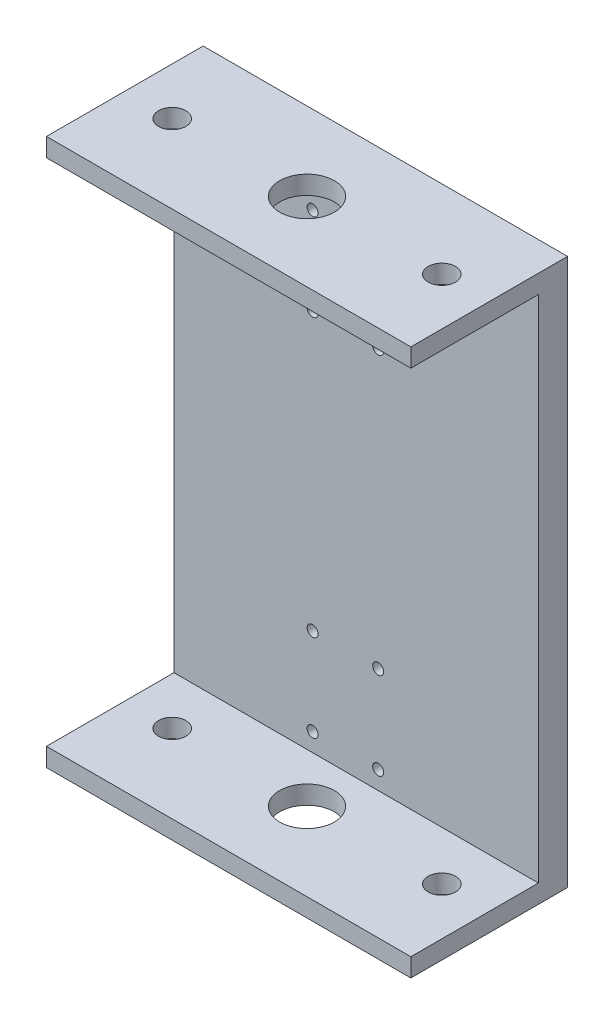
from build123d import *

# Parameters (mm, degrees)
SKETCH2_W           = 100
SKETCH2_H           = 150
SKETCH2_R           = 1.5
BOSS_EXTRUDE1_DEPTH = 8
SKETCH5_W           = 100
SKETCH5_H           = 5.066428815
BOSS_EXTRUDE2_DEPTH = 35
SKETCH7_R           = 7.5
SKETCH7_R_2         = 3.75
CUT_EXTRUDE2_DEPTH  = 290


with BuildPart() as part:
    # Sketch2 → Boss-Extrude1 (new body)
    with BuildSketch(Plane.XY):
        with Locations((-3.365, 15)):
            Rectangle(SKETCH2_W, SKETCH2_H)
        with Locations((-15.33, 74.016821687)):
            Circle(SKETCH2_R, mode=Mode.SUBTRACT)
        with Locations((-15.33, -25.983178313)):
            Circle(SKETCH2_R, mode=Mode.SUBTRACT)
        with Locations((-15.33, 50.088093446)):
            Circle(SKETCH2_R, mode=Mode.SUBTRACT)
        with Locations((2.67, 50.088093446)):
            Circle(SKETCH2_R, mode=Mode.SUBTRACT)
        with Locations((2.67, 74.016821687)):
            Circle(SKETCH2_R, mode=Mode.SUBTRACT)
        with Locations((-15.33, -49.911906554)):
            Circle(SKETCH2_R, mode=Mode.SUBTRACT)
        with Locations((2.67, -49.911906554)):
            Circle(SKETCH2_R, mode=Mode.SUBTRACT)
        with Locations((2.67, -25.983178313)):
            Circle(SKETCH2_R, mode=Mode.SUBTRACT)
    extrude(amount=BOSS_EXTRUDE1_DEPTH)

    # Sketch5 → Boss-Extrude2 (add)
    with BuildSketch(Plane.XY.offset(8)):
        with Locations((-3.365, 87.466785593)):
            Rectangle(SKETCH5_W, SKETCH5_H)
        Polygon((-13.365, -54.933571185), (-53.365, -54.933571185), (-53.365, -60), (-13.365, -60), (46.635, -60), (46.635, -54.933571185), align=None)
    extrude(amount=BOSS_EXTRUDE2_DEPTH)

    # Sketch7 → Cut-Extrude2 (cut)
    with BuildSketch(Plane(origin=(0, 90, 0), x_dir=(1, 0, 0), z_dir=(0, 1, 0))):
        with Locations((-3.365, -21.5)):
            Circle(SKETCH7_R)
        with Locations((-40.365, -21.5)):
            Circle(SKETCH7_R_2)
        with Locations((33.635, -21.5)):
            Circle(SKETCH7_R_2)
    extrude(amount=-CUT_EXTRUDE2_DEPTH, mode=Mode.SUBTRACT)


solid = part.part
